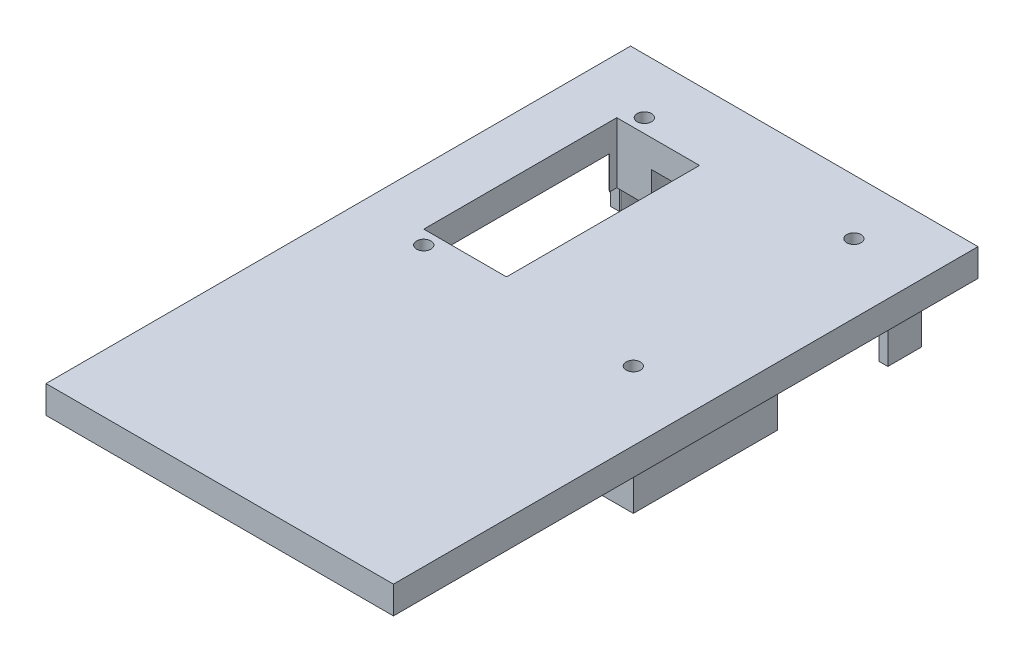
from build123d import *

# Parameters (mm, degrees)
SKETCH3_W           = 63
SKETCH3_H           = 60
BOSS_EXTRUDE3_DEPTH = 5
CUT_EXTRUDE1_REACH  = 56.314
SKETCH4_R           = 1.3
SKETCH9_R           = 4.55
SKETCH9_R_2         = 1.05
BOSS_EXTRUDE5_DEPTH = 6
SKETCH11_W          = 63
SKETCH11_H          = 5
BOSS_EXTRUDE7_DEPTH = 46
SKETCH12_W          = 50.3
SKETCH12_H          = 52.3
BOSS_EXTRUDE8_DEPTH = 12
SKETCH13_W          = 40
SKETCH13_H          = 12
CUT_EXTRUDE4_DEPTH  = 1.62
SKETCH14_W          = 20
SKETCH14_H          = 12
CUT_EXTRUDE5_DEPTH  = 1.62
SKETCH15_W          = 15
SKETCH15_H          = 12
CUT_EXTRUDE11_DEPTH = 1.62
SKETCH16_W          = 15
SKETCH16_H          = 35
CUT_EXTRUDE12_DEPTH = 90.944427287


with BuildPart() as part:
    # Sketch3 → Boss-Extrude3 (new body)
    with BuildSketch(Plane(origin=(0, 0, 0), x_dir=(1, 0, 0), z_dir=(0, 1, 0))):
        with Locations((-13.5, 0)):
            Rectangle(SKETCH3_W, SKETCH3_H)
    extrude(amount=BOSS_EXTRUDE3_DEPTH)

    # Sketch4 → Cut-Extrude1 (cut, up to next)
    with BuildSketch(Plane(origin=(0, 5, 0), x_dir=(1, 0, 0), z_dir=(0, 1, 0)), mode=Mode.PRIVATE) as cut_extrude1_sk1:
        with Locations((-32.5, 20)):
            Circle(SKETCH4_R)
    cut_extrude1_tool1 = extrude(cut_extrude1_sk1.sketch, amount=-CUT_EXTRUDE1_REACH, mode=Mode.PRIVATE) & part.part
    # Sketch4 → Cut-Extrude1 (cut, up to next)
    with BuildSketch(Plane(origin=(0, 5, 0), x_dir=(1, 0, 0), z_dir=(0, 1, 0)), mode=Mode.PRIVATE) as cut_extrude1_sk2:
        with Locations((5.5, 20)):
            Circle(SKETCH4_R)
    cut_extrude1_tool2 = extrude(cut_extrude1_sk2.sketch, amount=-CUT_EXTRUDE1_REACH, mode=Mode.PRIVATE) & part.part
    # Sketch4 → Cut-Extrude1 (cut, up to next)
    with BuildSketch(Plane(origin=(0, 5, 0), x_dir=(1, 0, 0), z_dir=(0, 1, 0)), mode=Mode.PRIVATE) as cut_extrude1_sk3:
        with Locations((5.5, -20)):
            Circle(SKETCH4_R)
    cut_extrude1_tool3 = extrude(cut_extrude1_sk3.sketch, amount=-CUT_EXTRUDE1_REACH, mode=Mode.PRIVATE) & part.part
    # Sketch4 → Cut-Extrude1 (cut, up to next)
    with BuildSketch(Plane(origin=(0, 5, 0), x_dir=(1, 0, 0), z_dir=(0, 1, 0)), mode=Mode.PRIVATE) as cut_extrude1_sk4:
        with Locations((-32.5, -20)):
            Circle(SKETCH4_R)
    cut_extrude1_tool4 = extrude(cut_extrude1_sk4.sketch, amount=-CUT_EXTRUDE1_REACH, mode=Mode.PRIVATE) & part.part
    add(cut_extrude1_tool1.solids().sort_by_distance((-32.5, 5, -20))[0], mode=Mode.SUBTRACT)
    add(cut_extrude1_tool2.solids().sort_by_distance((5.5, 5, -20))[0], mode=Mode.SUBTRACT)
    add(cut_extrude1_tool3.solids().sort_by_distance((5.5, 5, 20))[0], mode=Mode.SUBTRACT)
    add(cut_extrude1_tool4.solids().sort_by_distance((-32.5, 5, 20))[0], mode=Mode.SUBTRACT)

    # Sketch9 → Boss-Extrude5 (add)
    # profile 1 of 4: a face of its own
    with BuildSketch(Plane.XZ):
        with Locations((-32.5, 20)):
            Circle(SKETCH9_R)
        with Locations((-32.5, 20)):
            Circle(SKETCH9_R_2, mode=Mode.SUBTRACT)
    # profile 2 of 4: a face of its own
    with BuildSketch(Plane.XZ):
        with Locations((-32.5, -20)):
            Circle(SKETCH9_R)
        with Locations((-32.5, -20)):
            Circle(SKETCH9_R_2, mode=Mode.SUBTRACT)
    # profile 3 of 4: a face of its own
    with BuildSketch(Plane.XZ):
        with Locations((5.5, 20)):
            Circle(SKETCH9_R)
        with Locations((5.5, 20)):
            Circle(SKETCH9_R_2, mode=Mode.SUBTRACT)
    # profile 4 of 4: a face of its own
    with BuildSketch(Plane.XZ):
        with Locations((5.5, -20)):
            Circle(SKETCH9_R)
        with Locations((5.5, -20)):
            Circle(SKETCH9_R_2, mode=Mode.SUBTRACT)
    extrude(amount=BOSS_EXTRUDE5_DEPTH)

    # Sketch11 → Boss-Extrude7 (add)
    with BuildSketch(Plane.XY.offset(30)):
        with Locations((-13.5, 2.5)):
            Rectangle(SKETCH11_W, SKETCH11_H)
    extrude(amount=BOSS_EXTRUDE7_DEPTH)

    # Sketch12 → Boss-Extrude8 (add)
    with BuildSketch(Plane.XZ):
        with Locations((-13.5, 0)):
            Rectangle(SKETCH12_W, SKETCH12_H)
        with BuildLine():
            Line((-32.889447937, 24.533302362), (5.889447937, 24.533302362))
            ThreePointArc((5.889447937, 24.533302362), (8.819595501, 23.319595501), (10.033302362, 20.389447937))
            Line((10.033302362, 20.389447937), (10.033302362, -20.389447937))
            ThreePointArc((10.033302362, -20.389447937), (8.819595501, -23.319595501), (5.889447937, -24.533302362))
            Line((5.889447937, -24.533302362), (-32.889447937, -24.533302362))
            ThreePointArc((-32.889447937, -24.533302362), (-35.819595501, -23.319595501), (-37.033302362, -20.389447937))
            Line((-37.033302362, -20.389447937), (-37.033302362, 20.389447937))
            ThreePointArc((-37.033302362, 20.389447937), (-35.819595501, 23.319595501), (-32.889447937, 24.533302362))
        make_face(mode=Mode.SUBTRACT)
    extrude(amount=BOSS_EXTRUDE8_DEPTH)

    # Sketch13 → Cut-Extrude4 (cut)
    with BuildSketch(Plane.ZY.offset(38.65)):
        with Locations((0, -6)):
            Rectangle(SKETCH13_W, SKETCH13_H)
    extrude(amount=-CUT_EXTRUDE4_DEPTH, mode=Mode.SUBTRACT)

    # Sketch14 → Cut-Extrude5 (cut)
    with BuildSketch(Plane(origin=(11.65, 0, 0), x_dir=(0, 0, -1), z_dir=(1, 0, 0))):
        with Locations((10, -6)):
            Rectangle(SKETCH14_W, SKETCH14_H)
    extrude(amount=-CUT_EXTRUDE5_DEPTH, mode=Mode.SUBTRACT)

    # Sketch15 → Cut-Extrude11 (cut)
    with BuildSketch(Plane.XY.offset(26.15)):
        with Locations((-1.65, -6)):
            Rectangle(SKETCH15_W, SKETCH15_H)
    extrude(amount=-CUT_EXTRUDE11_DEPTH, mode=Mode.SUBTRACT)

    # Sketch16 → Cut-Extrude12 (cut, through all)
    with BuildSketch(Plane(origin=(0, 5, 0), x_dir=(1, 0, 0), z_dir=(0, 1, 0))):
        with Locations((-27.5, 0)):
            Rectangle(SKETCH16_W, SKETCH16_H)
    extrude(amount=-CUT_EXTRUDE12_DEPTH, mode=Mode.SUBTRACT)


solid = part.part
